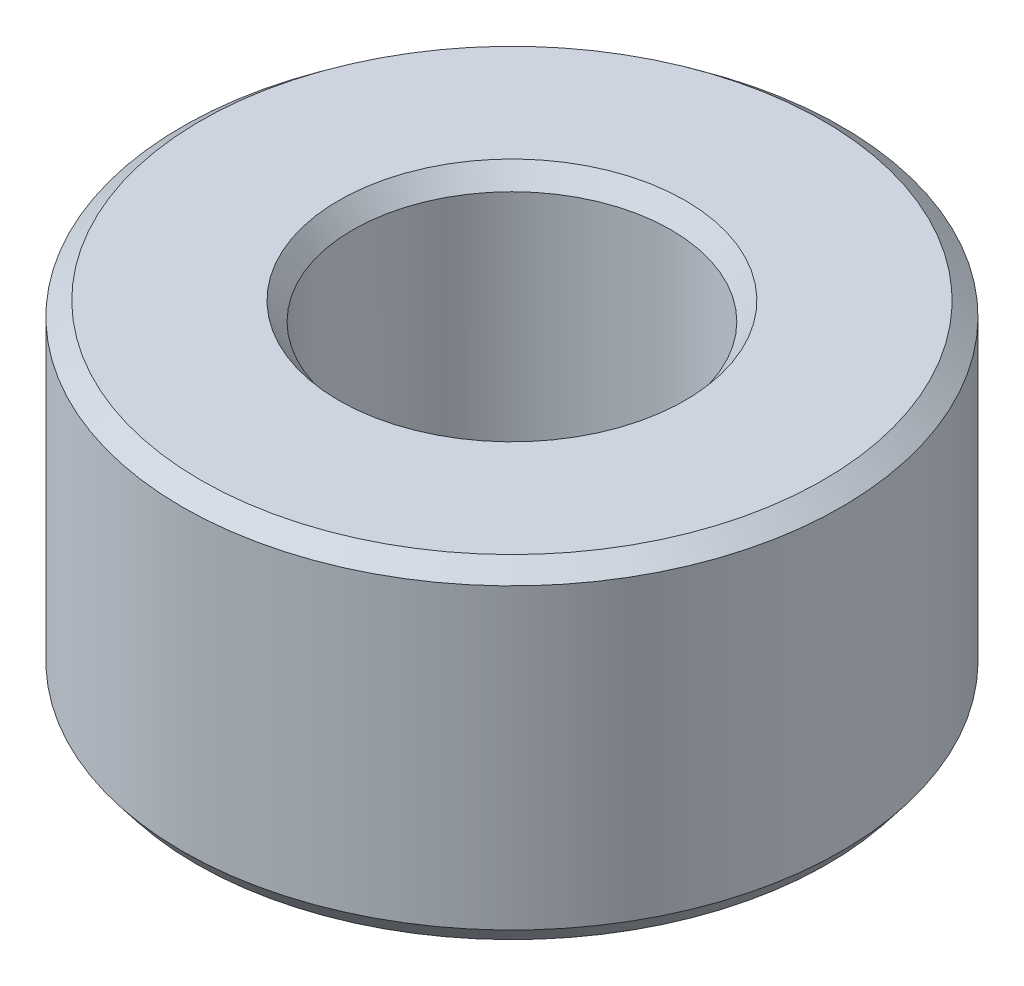
from build123d import *
from OCP.BRepFilletAPI import BRepFilletAPI_MakeChamfer

# Parameters (mm, degrees)
SKETCH1_R           = 52.5
BOSS_EXTRUDE1_DEPTH = 52.657119303
SKETCH2_R           = 25.334992589
CUT_EXTRUDE1_DEPTH  = 92.023470673
CHAMFER1_SIZE       = 2.258880533
CHAMFER1_SIZE2      = 2.917284911


with BuildPart() as part:
    # Sketch1 → Boss-Extrude1 (new body)
    with BuildSketch(Plane(origin=(0, 0, 0), x_dir=(1, 0, 0), z_dir=(0, 1, 0))):
        Circle(SKETCH1_R)
    extrude(amount=BOSS_EXTRUDE1_DEPTH)

    # Sketch2 → Cut-Extrude1 (cut, through all)
    with BuildSketch(Plane(origin=(0, 0, 0), x_dir=(1, 0, 0), z_dir=(0, 1, 0))):
        Circle(SKETCH2_R)
    extrude(amount=CUT_EXTRUDE1_DEPTH, mode=Mode.SUBTRACT)

    # Chamfer1: one chamfer whose edges measure the first distance from different faces: ONE call of the kernel's chamfer builder (chamfer() names one face for all edges)
    chamfer1_edges_1 = [part.edges().sort_by_distance(p)[0] for p in [
        (-25.334992589, 52.657119303, 0),
    ]]
    chamfer1_side_1 = [part.faces().sort_by_distance(p)[0] for p in [
        (-51.01507576, 52.657119303, 0),
    ]]
    chamfer1_edges_2 = [part.edges().sort_by_distance(p)[0] for p in [
        (-25.334992589, 0, 0),
    ]]
    chamfer1_side_2 = [part.faces().sort_by_distance(p)[0] for p in [
        (-25.334992589, 26.328559652, 0),
    ]]
    chamfer1_edges_3 = [part.edges().sort_by_distance(p)[0] for p in [
        (-52.5, 0, 0),
    ]]
    chamfer1_side_3 = [part.faces().sort_by_distance(p)[0] for p in [
        (-51.01507576, 0, 0),
    ]]
    chamfer1_edges_4 = [part.edges().sort_by_distance(p)[0] for p in [
        (-52.5, 52.657119303, 0),
    ]]
    chamfer1_side_4 = [part.faces().sort_by_distance(p)[0] for p in [
        (-52.5, 26.328559652, 0),
    ]]
    chamfer1 = BRepFilletAPI_MakeChamfer(part.part.solid().wrapped)
    for e in chamfer1_edges_1:
        chamfer1.Add(CHAMFER1_SIZE, CHAMFER1_SIZE2, e.wrapped, chamfer1_side_1[0].wrapped)  # the first distance lies on this face
    for e in chamfer1_edges_2:
        chamfer1.Add(CHAMFER1_SIZE, CHAMFER1_SIZE2, e.wrapped, chamfer1_side_2[0].wrapped)  # the first distance lies on this face
    for e in chamfer1_edges_3:
        chamfer1.Add(CHAMFER1_SIZE, CHAMFER1_SIZE2, e.wrapped, chamfer1_side_3[0].wrapped)  # the first distance lies on this face
    for e in chamfer1_edges_4:
        chamfer1.Add(CHAMFER1_SIZE, CHAMFER1_SIZE2, e.wrapped, chamfer1_side_4[0].wrapped)  # the first distance lies on this face
    add(Compound.cast(chamfer1.Shape()), mode=Mode.REPLACE)


solid = part.part
